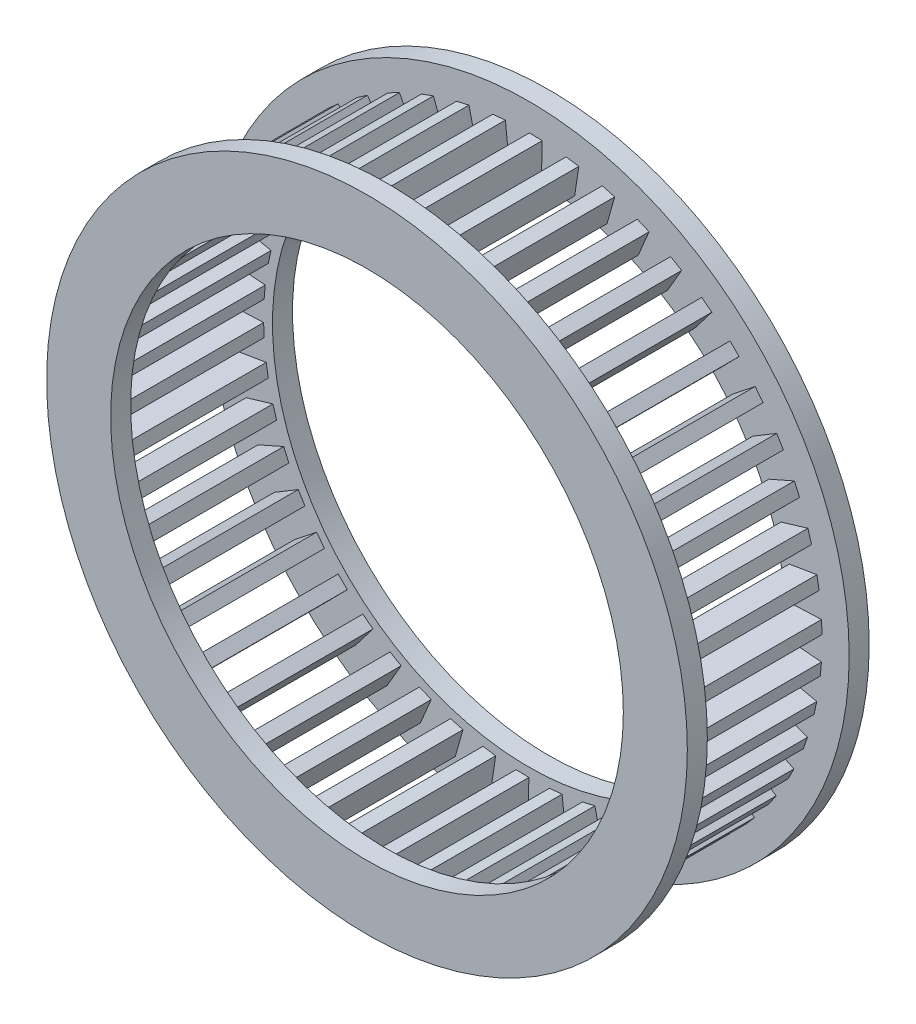
from build123d import *

# Parameters (mm, degrees)
CAGE_50_BARS_START    = -15.1
CAGE_50_BARS_DEPTH    = 30.2
CAGE_50_BARS_2_DEPTH  = 30.2
CAGE_50_BARS_3_DEPTH  = 30.2
CAGE_50_BARS_4_DEPTH  = 30.2
CAGE_50_BARS_5_DEPTH  = 30.2
CAGE_50_BARS_6_DEPTH  = 30.2
CAGE_50_BARS_7_DEPTH  = 30.2
CAGE_50_BARS_8_DEPTH  = 30.2
CAGE_50_BARS_9_DEPTH  = 30.2
CAGE_50_BARS_10_DEPTH = 30.2
CAGE_50_BARS_11_DEPTH = 30.2
CAGE_50_BARS_12_DEPTH = 30.2
CAGE_50_BARS_13_DEPTH = 30.2
CAGE_50_BARS_14_DEPTH = 30.2
CAGE_50_BARS_15_DEPTH = 30.2
CAGE_50_BARS_16_DEPTH = 30.2
CAGE_50_BARS_17_DEPTH = 30.2
CAGE_50_BARS_18_DEPTH = 30.2
CAGE_50_BARS_19_DEPTH = 30.2
CAGE_50_BARS_20_DEPTH = 30.2
CAGE_50_BARS_21_DEPTH = 30.2
CAGE_50_BARS_22_DEPTH = 30.2
CAGE_50_BARS_23_DEPTH = 30.2
CAGE_50_BARS_24_DEPTH = 30.2
CAGE_50_BARS_25_DEPTH = 30.2
CAGE_50_BARS_26_DEPTH = 30.2
CAGE_50_BARS_27_DEPTH = 30.2
CAGE_50_BARS_28_DEPTH = 30.2
CAGE_50_BARS_29_DEPTH = 30.2
CAGE_50_BARS_30_DEPTH = 30.2
CAGE_50_BARS_31_DEPTH = 30.2
CAGE_50_BARS_32_DEPTH = 30.2
CAGE_50_BARS_33_DEPTH = 30.2
CAGE_50_BARS_34_DEPTH = 30.2
CAGE_50_BARS_35_DEPTH = 30.2
CAGE_50_BARS_36_DEPTH = 30.2
CAGE_50_BARS_37_DEPTH = 30.2
CAGE_50_BARS_38_DEPTH = 30.2
CAGE_50_BARS_39_DEPTH = 30.2
CAGE_50_BARS_40_DEPTH = 30.2
CAGE_50_BARS_41_DEPTH = 30.2
CAGE_50_BARS_42_DEPTH = 30.2
CAGE_50_BARS_43_DEPTH = 30.2
CAGE_50_BARS_44_DEPTH = 30.2
CAGE_50_BARS_45_DEPTH = 30.2
CAGE_50_BARS_46_DEPTH = 30.2
CAGE_50_BARS_47_DEPTH = 30.2
CAGE_50_BARS_48_DEPTH = 30.2
CAGE_50_BARS_49_DEPTH = 30.2
CAGE_50_BARS_50_DEPTH = 30.2
CAGE_RING_RIGHT_START = 15
SKETCH_2_R            = 67.753846154
SKETCH_2_R_2          = 54.215384615
CAGE_RING_RIGHT_DEPTH = 4.230769231
CAGE_RING_LEFT_START  = -19.230769231
SKETCH_3_R            = 67.753846154
SKETCH_3_R_2          = 54.215384615
CAGE_RING_LEFT_DEPTH  = 4.230769231


with BuildPart() as part:
    # Эскиз1 → Cage_50_bars (new body)
    with BuildSketch(Plane.XY.offset(CAGE_50_BARS_START)):
        Polygon((56.087105432, 0.831147038), (62.00568864, 1.061826581), (61.900235135, 3.767464618), (55.981651927, 3.536785076), align=None)
    extrude(amount=CAGE_50_BARS_DEPTH)



with BuildPart() as body_2:
    # Эскиз1 → Cage_50_bars 2 (new body)
    with BuildSketch(Plane.XY.offset(CAGE_50_BARS_START)):
        Polygon((55.540671508, 7.854171481), (61.383673106, 8.824827218), (60.939944769, 11.495913662), (55.096943171, 10.525257926), align=None)
    extrude(amount=CAGE_50_BARS_2_DEPTH)


with BuildPart() as body_3:
    # Эскиз1 → Cage_50_bars 3 (new body)
    with BuildSketch(Plane.XY.offset(CAGE_50_BARS_START)):
        Polygon((54.118328015, 14.753330947), (59.793600378, 16.448655058), (59.018595071, 19.043065281), (53.343322707, 17.34774117), align=None)
    extrude(amount=CAGE_50_BARS_3_DEPTH)


with BuildPart() as body_4:
    # Эскиз1 → Cage_50_bars 4 (new body)
    with BuildSketch(Plane.XY.offset(CAGE_50_BARS_START)):
        Polygon((51.842506161, 21.419821571), (57.260546854, 23.813077781), (56.166486872, 26.289896384), (50.748446179, 23.896640174), align=None)
    extrude(amount=CAGE_50_BARS_4_DEPTH)


with BuildPart() as body_5:
    # Эскиз1 → Cage_50_bars 5 (new body)
    with BuildSketch(Plane.XY.offset(CAGE_50_BARS_START)):
        Polygon((48.749097015, 27.748508814), (53.824460299, 30.801954043), (52.428599623, 33.122120116), (47.353236339, 30.068674886), align=None)
    extrude(amount=CAGE_50_BARS_5_DEPTH)


with BuildPart() as body_6:
    # Эскиз1 → Cage_50_bars 6 (new body)
    with BuildSketch(Plane.XY.offset(CAGE_50_BARS_START)):
        Polygon((44.886885489, 33.639585496), (49.539529853, 37.30506509), (47.863882039, 39.431988228), (43.211237674, 35.766508634), align=None)
    extrude(amount=CAGE_50_BARS_6_DEPTH)


with BuildPart() as body_7:
    # Эскиз1 → Cage_50_bars 7 (new body)
    with BuildSketch(Plane.XY.offset(CAGE_50_BARS_START)):
        Polygon((40.316780963, 39.000145819), (44.473331427, 43.219852975), (42.544322442, 45.11999033), (38.387771978, 40.900283174), align=None)
    extrude(amount=CAGE_50_BARS_7_DEPTH)


with BuildPart() as body_8:
    # Эскиз1 → Cage_50_bars 8 (new body)
    with BuildSketch(Plane.XY.offset(CAGE_50_BARS_START)):
        Polygon((35.110856718, 43.745650546), (38.705761998, 48.45303796), (36.553813466, 50.096423231), (32.958908186, 45.389035817), align=None)
    extrude(amount=CAGE_50_BARS_8_DEPTH)


with BuildPart() as body_9:
    # Эскиз1 → Cage_50_bars 9 (new body)
    with BuildSketch(Plane.XY.offset(CAGE_50_BARS_START)):
        Polygon((29.351213289, 47.801260231), (32.32777958, 52.922089592), (29.986829015, 54.282805611), (27.010262724, 49.16197625), align=None)
    extrude(amount=CAGE_50_BARS_9_DEPTH)


with BuildPart() as body_10:
    # Эскиз1 → Cage_50_bars 10 (new body)
    with BuildSketch(Plane.XY.offset(CAGE_50_BARS_START)):
        Polygon((23.128683692, 51.103015487), (25.439968767, 56.556528258), (22.946934357, 57.61311572), (20.635649283, 52.15960295), align=None)
    extrude(amount=CAGE_50_BARS_10_DEPTH)


with BuildPart() as body_11:
    # Эскиз1 → Cage_50_bars 11 (new body)
    with BuildSketch(Plane.XY.offset(CAGE_50_BARS_START)):
        Polygon((16.541400937, 53.598845661), (18.150954449, 59.299036687), (15.545152837, 60.034832578), (13.935599325, 54.334641552), align=None)
    extrude(amount=CAGE_50_BARS_11_DEPTH)


with BuildPart() as body_12:
    # Эскиз1 → Cage_50_bars 12 (new body)
    with BuildSketch(Plane.XY.offset(CAGE_50_BARS_START)):
        Polygon((9.693250408, 55.249390021), (10.575688736, 61.106363884), (7.89821497, 61.509764263), (7.015776642, 55.6527904), align=None)
    extrude(amount=CAGE_50_BARS_12_DEPTH)


with BuildPart() as body_13:
    # Эскиз1 → Cage_50_bars 13 (new body)
    with BuildSketch(Plane.XY.offset(CAGE_50_BARS_START)):
        Polygon((2.69223153, 56.028618496), (2.833638095, 61.95000722), (0.126717536, 62.014650221), (-0.01468903, 56.093261497), align=None)
    extrude(amount=CAGE_50_BARS_13_DEPTH)


with BuildPart() as body_14:
    # Эскиз1 → Cage_50_bars 14 (new body)
    with BuildSketch(Plane.XY.offset(CAGE_50_BARS_START)):
        Polygon((-4.351245448, 55.924242187), (-4.953100712, 61.816661935), (-7.646778311, 61.5415281), (-7.044923047, 55.649108353), align=None)
    extrude(amount=CAGE_50_BARS_14_DEPTH)


with BuildPart() as body_15:
    # Эскиз1 → Cage_50_bars 15 (new body)
    with BuildSketch(Plane.XY.offset(CAGE_50_BARS_START)):
        Polygon((-11.326100686, 54.937907172), (-12.661726162, 60.708430963), (-15.299679895, 60.097859317), (-13.96405442, 54.327335526), align=None)
    extrude(amount=CAGE_50_BARS_15_DEPTH)


with BuildPart() as body_16:
    # Эскиз1 → Cage_50_bars 16 (new body)
    with BuildSketch(Plane.XY.offset(CAGE_50_BARS_START)):
        Polygon((-18.122336551, 53.085168542), (-20.170668626, 58.64279177), (-22.711296388, 57.706411392), (-20.662964312, 52.148788164), align=None)
    extrude(amount=CAGE_50_BARS_16_DEPTH)


with BuildPart() as body_17:
    # Эскиз1 → Cage_50_bars 17 (new body)
    with BuildSketch(Plane.XY.offset(CAGE_50_BARS_START)):
        Polygon((-24.632772342, 50.395245093), (-27.361507597, 55.652320719), (-29.764742169, 54.404898888), (-27.036006914, 49.147823261), align=None)
    extrude(amount=CAGE_50_BARS_17_DEPTH)


with BuildPart() as body_18:
    # Эскиз1 → Cage_50_bars 18 (new body)
    with BuildSketch(Plane.XY.offset(CAGE_50_BARS_START)):
        Polygon((-30.754734598, 46.910558523), (-34.120839249, 51.784179325), (-36.348780186, 50.245388628), (-32.982675536, 45.371767826), align=None)
    extrude(amount=CAGE_50_BARS_18_DEPTH)


with BuildPart() as body_19:
    # Эскиз1 → Cage_50_bars 19 (new body)
    with BuildSketch(Plane.XY.offset(CAGE_50_BARS_START)):
        Polygon((-36.391676318, 42.686064423), (-40.342064882, 47.099370489), (-42.359576226, 45.293478574), (-38.409187662, 40.880172508), align=None)
    extrude(amount=CAGE_50_BARS_19_DEPTH)


with BuildPart() as body_20:
    # Эскиз1 → Cage_50_bars 20 (new body)
    with BuildSketch(Plane.XY.offset(CAGE_50_BARS_START)):
        Polygon((-41.454699563, 37.788385588), (-45.927072053, 41.671776445), (-47.702336445, 39.627263306), (-43.229963954, 35.74387245), align=None)
    extrude(amount=CAGE_50_BARS_20_DEPTH)


with BuildPart() as body_21:
    # Эскиз1 → Cage_50_bars 21 (new body)
    with BuildSketch(Plane.XY.offset(CAGE_50_BARS_START)):
        Polygon((-45.863957432, 32.294761338), (-50.787781862, 35.586993592), (-52.292802321, 33.336102424), (-47.368977891, 30.04387017), align=None)
    extrude(amount=CAGE_50_BARS_21_DEPTH)


with BuildPart() as body_22:
    # Эскиз1 → Cage_50_bars 22 (new body)
    with BuildSketch(Plane.XY.offset(CAGE_50_BARS_START)):
        Polygon((-49.549913294, 26.29182941), (-54.847538012, 28.940982592), (-56.058579467, 26.519211292), (-50.760954749, 23.87005811), align=None)
    extrude(amount=CAGE_50_BARS_22_DEPTH)


with BuildPart() as body_23:
    # Эскиз1 → Cage_50_bars 23 (new body)
    with BuildSketch(Plane.XY.offset(CAGE_50_BARS_START)):
        Polygon((-52.454437424, 19.874259626), (-58.042315724, 21.838555008), (-58.940279327, 19.284096356), (-53.352401027, 17.319800975), align=None)
    extrude(amount=CAGE_50_BARS_23_DEPTH)


with BuildPart() as body_24:
    # Эскиз1 → Cage_50_bars 24 (new body)
    with BuildSketch(Plane.XY.offset(CAGE_50_BARS_START)):
        Polygon((-54.531723741, 13.143260896), (-60.321731443, 14.391720365), (-60.892455772, 11.744859702), (-55.10244807, 10.496400232), align=None)
    extrude(amount=CAGE_50_BARS_24_DEPTH)


with BuildPart() as body_25:
    # Эскиз1 → Cage_50_bars 25 (new body)
    with BuildSketch(Plane.XY.offset(CAGE_50_BARS_START)):
        Polygon((-55.7490122, 6.204985089), (-61.649837424, 6.717919696), (-61.884321815, 4.020399593), (-55.983496591, 3.507464987), align=None)
    extrude(amount=CAGE_50_BARS_25_DEPTH)


with BuildPart() as body_26:
    # Эскиз1 → Cage_50_bars 26 (new body)
    with BuildSketch(Plane.XY.offset(CAGE_50_BARS_START)):
        Polygon((-56.087105432, -0.831147038), (-62.00568864, -1.061826581), (-61.900235135, -3.767464618), (-55.981651927, -3.536785076), align=None)
    extrude(amount=CAGE_50_BARS_26_DEPTH)


with BuildPart() as body_27:
    # Эскиз1 → Cage_50_bars 27 (new body)
    with BuildSketch(Plane.XY.offset(CAGE_50_BARS_START)):
        Polygon((-55.540671508, -7.854171481), (-61.383673106, -8.824827218), (-60.939944769, -11.495913662), (-55.096943171, -10.525257926), align=None)
    extrude(amount=CAGE_50_BARS_27_DEPTH)


with BuildPart() as body_28:
    # Эскиз1 → Cage_50_bars 28 (new body)
    with BuildSketch(Plane.XY.offset(CAGE_50_BARS_START)):
        Polygon((-54.118328015, -14.753330947), (-59.793600378, -16.448655058), (-59.018595071, -19.043065281), (-53.343322707, -17.34774117), align=None)
    extrude(amount=CAGE_50_BARS_28_DEPTH)


with BuildPart() as body_29:
    # Эскиз1 → Cage_50_bars 29 (new body)
    with BuildSketch(Plane.XY.offset(CAGE_50_BARS_START)):
        Polygon((-51.842506161, -21.419821571), (-57.260546854, -23.813077781), (-56.166486872, -26.289896384), (-50.748446179, -23.896640174), align=None)
    extrude(amount=CAGE_50_BARS_29_DEPTH)


with BuildPart() as body_30:
    # Эскиз1 → Cage_50_bars 30 (new body)
    with BuildSketch(Plane.XY.offset(CAGE_50_BARS_START)):
        Polygon((-48.749097015, -27.748508814), (-53.824460299, -30.801954043), (-52.428599623, -33.122120116), (-47.353236339, -30.068674886), align=None)
    extrude(amount=CAGE_50_BARS_30_DEPTH)


with BuildPart() as body_31:
    # Эскиз1 → Cage_50_bars 31 (new body)
    with BuildSketch(Plane.XY.offset(CAGE_50_BARS_START)):
        Polygon((-44.886885489, -33.639585496), (-49.539529853, -37.30506509), (-47.863882039, -39.431988228), (-43.211237674, -35.766508634), align=None)
    extrude(amount=CAGE_50_BARS_31_DEPTH)


with BuildPart() as body_32:
    # Эскиз1 → Cage_50_bars 32 (new body)
    with BuildSketch(Plane.XY.offset(CAGE_50_BARS_START)):
        Polygon((-40.316780963, -39.000145819), (-44.473331427, -43.219852975), (-42.544322442, -45.11999033), (-38.387771978, -40.900283174), align=None)
    extrude(amount=CAGE_50_BARS_32_DEPTH)


with BuildPart() as body_33:
    # Эскиз1 → Cage_50_bars 33 (new body)
    with BuildSketch(Plane.XY.offset(CAGE_50_BARS_START)):
        Polygon((-35.110856718, -43.745650546), (-38.705761998, -48.45303796), (-36.553813466, -50.096423231), (-32.958908186, -45.389035817), align=None)
    extrude(amount=CAGE_50_BARS_33_DEPTH)


with BuildPart() as body_34:
    # Эскиз1 → Cage_50_bars 34 (new body)
    with BuildSketch(Plane.XY.offset(CAGE_50_BARS_START)):
        Polygon((-29.351213289, -47.801260231), (-32.32777958, -52.922089592), (-29.986829015, -54.282805611), (-27.010262724, -49.16197625), align=None)
    extrude(amount=CAGE_50_BARS_34_DEPTH)


with BuildPart() as body_35:
    # Эскиз1 → Cage_50_bars 35 (new body)
    with BuildSketch(Plane.XY.offset(CAGE_50_BARS_START)):
        Polygon((-23.128683692, -51.103015487), (-25.439968767, -56.556528258), (-22.946934357, -57.61311572), (-20.635649283, -52.15960295), align=None)
    extrude(amount=CAGE_50_BARS_35_DEPTH)


with BuildPart() as body_36:
    # Эскиз1 → Cage_50_bars 36 (new body)
    with BuildSketch(Plane.XY.offset(CAGE_50_BARS_START)):
        Polygon((-16.541400937, -53.598845661), (-18.150954449, -59.299036687), (-15.545152837, -60.034832578), (-13.935599325, -54.334641552), align=None)
    extrude(amount=CAGE_50_BARS_36_DEPTH)


with BuildPart() as body_37:
    # Эскиз1 → Cage_50_bars 37 (new body)
    with BuildSketch(Plane.XY.offset(CAGE_50_BARS_START)):
        Polygon((-9.693250408, -55.249390021), (-10.575688736, -61.106363884), (-7.89821497, -61.509764263), (-7.015776642, -55.6527904), align=None)
    extrude(amount=CAGE_50_BARS_37_DEPTH)


with BuildPart() as body_38:
    # Эскиз1 → Cage_50_bars 38 (new body)
    with BuildSketch(Plane.XY.offset(CAGE_50_BARS_START)):
        Polygon((-2.69223153, -56.028618496), (-2.833638095, -61.95000722), (-0.126717536, -62.014650221), (0.01468903, -56.093261497), align=None)
    extrude(amount=CAGE_50_BARS_38_DEPTH)


with BuildPart() as body_39:
    # Эскиз1 → Cage_50_bars 39 (new body)
    with BuildSketch(Plane.XY.offset(CAGE_50_BARS_START)):
        Polygon((4.351245448, -55.924242187), (4.953100712, -61.816661935), (7.646778311, -61.5415281), (7.044923047, -55.649108353), align=None)
    extrude(amount=CAGE_50_BARS_39_DEPTH)


with BuildPart() as body_40:
    # Эскиз1 → Cage_50_bars 40 (new body)
    with BuildSketch(Plane.XY.offset(CAGE_50_BARS_START)):
        Polygon((11.326100686, -54.937907172), (12.661726162, -60.708430963), (15.299679895, -60.097859317), (13.96405442, -54.327335526), align=None)
    extrude(amount=CAGE_50_BARS_40_DEPTH)


with BuildPart() as body_41:
    # Эскиз1 → Cage_50_bars 41 (new body)
    with BuildSketch(Plane.XY.offset(CAGE_50_BARS_START)):
        Polygon((18.122336551, -53.085168542), (20.170668626, -58.64279177), (22.711296388, -57.706411392), (20.662964312, -52.148788164), align=None)
    extrude(amount=CAGE_50_BARS_41_DEPTH)


with BuildPart() as body_42:
    # Эскиз1 → Cage_50_bars 42 (new body)
    with BuildSketch(Plane.XY.offset(CAGE_50_BARS_START)):
        Polygon((24.632772342, -50.395245093), (27.361507597, -55.652320719), (29.764742169, -54.404898888), (27.036006914, -49.147823261), align=None)
    extrude(amount=CAGE_50_BARS_42_DEPTH)


with BuildPart() as body_43:
    # Эскиз1 → Cage_50_bars 43 (new body)
    with BuildSketch(Plane.XY.offset(CAGE_50_BARS_START)):
        Polygon((30.754734598, -46.910558523), (34.120839249, -51.784179325), (36.348780186, -50.245388628), (32.982675536, -45.371767826), align=None)
    extrude(amount=CAGE_50_BARS_43_DEPTH)


with BuildPart() as body_44:
    # Эскиз1 → Cage_50_bars 44 (new body)
    with BuildSketch(Plane.XY.offset(CAGE_50_BARS_START)):
        Polygon((36.391676318, -42.686064423), (40.342064882, -47.099370489), (42.359576226, -45.293478574), (38.409187662, -40.880172508), align=None)
    extrude(amount=CAGE_50_BARS_44_DEPTH)


with BuildPart() as body_45:
    # Эскиз1 → Cage_50_bars 45 (new body)
    with BuildSketch(Plane.XY.offset(CAGE_50_BARS_START)):
        Polygon((41.454699563, -37.788385588), (45.927072053, -41.671776445), (47.702336445, -39.627263306), (43.229963954, -35.74387245), align=None)
    extrude(amount=CAGE_50_BARS_45_DEPTH)


with BuildPart() as body_46:
    # Эскиз1 → Cage_50_bars 46 (new body)
    with BuildSketch(Plane.XY.offset(CAGE_50_BARS_START)):
        Polygon((45.863957432, -32.294761338), (50.787781862, -35.586993592), (52.292802321, -33.336102424), (47.368977891, -30.04387017), align=None)
    extrude(amount=CAGE_50_BARS_46_DEPTH)


with BuildPart() as body_47:
    # Эскиз1 → Cage_50_bars 47 (new body)
    with BuildSketch(Plane.XY.offset(CAGE_50_BARS_START)):
        Polygon((49.549913294, -26.29182941), (54.847538012, -28.940982592), (56.058579467, -26.519211292), (50.760954749, -23.87005811), align=None)
    extrude(amount=CAGE_50_BARS_47_DEPTH)


with BuildPart() as body_48:
    # Эскиз1 → Cage_50_bars 48 (new body)
    with BuildSketch(Plane.XY.offset(CAGE_50_BARS_START)):
        Polygon((52.454437424, -19.874259626), (58.042315724, -21.838555008), (58.940279327, -19.284096356), (53.352401027, -17.319800975), align=None)
    extrude(amount=CAGE_50_BARS_48_DEPTH)


with BuildPart() as body_49:
    # Эскиз1 → Cage_50_bars 49 (new body)
    with BuildSketch(Plane.XY.offset(CAGE_50_BARS_START)):
        Polygon((54.531723741, -13.143260896), (60.321731443, -14.391720365), (60.892455772, -11.744859702), (55.10244807, -10.496400232), align=None)
    extrude(amount=CAGE_50_BARS_49_DEPTH)


with BuildPart() as body_50:
    # Эскиз1 → Cage_50_bars 50 (new body)
    with BuildSketch(Plane.XY.offset(CAGE_50_BARS_START)):
        Polygon((55.7490122, -6.204985089), (61.649837424, -6.717919696), (61.884321815, -4.020399593), (55.983496591, -3.507464987), align=None)
    extrude(amount=CAGE_50_BARS_50_DEPTH)


with BuildPart() as part_1:
    add(part.part)

    add(body_2.part)  # Cage_ring_right merges body 2

    add(body_3.part)  # Cage_ring_right merges body 3

    add(body_4.part)  # Cage_ring_right merges body 4

    add(body_5.part)  # Cage_ring_right merges body 5

    add(body_6.part)  # Cage_ring_right merges body 6

    add(body_7.part)  # Cage_ring_right merges body 7

    add(body_8.part)  # Cage_ring_right merges body 8

    add(body_9.part)  # Cage_ring_right merges body 9

    add(body_10.part)  # Cage_ring_right merges body 10

    add(body_11.part)  # Cage_ring_right merges body 11

    add(body_12.part)  # Cage_ring_right merges body 12

    add(body_13.part)  # Cage_ring_right merges body 13

    add(body_14.part)  # Cage_ring_right merges body 14

    add(body_15.part)  # Cage_ring_right merges body 15

    add(body_16.part)  # Cage_ring_right merges body 16

    add(body_17.part)  # Cage_ring_right merges body 17

    add(body_18.part)  # Cage_ring_right merges body 18

    add(body_19.part)  # Cage_ring_right merges body 19

    add(body_20.part)  # Cage_ring_right merges body 20

    add(body_21.part)  # Cage_ring_right merges body 21

    add(body_22.part)  # Cage_ring_right merges body 22

    add(body_23.part)  # Cage_ring_right merges body 23

    add(body_24.part)  # Cage_ring_right merges body 24

    add(body_25.part)  # Cage_ring_right merges body 25

    add(body_26.part)  # Cage_ring_right merges body 26

    add(body_27.part)  # Cage_ring_right merges body 27

    add(body_28.part)  # Cage_ring_right merges body 28

    add(body_29.part)  # Cage_ring_right merges body 29

    add(body_30.part)  # Cage_ring_right merges body 30

    add(body_31.part)  # Cage_ring_right merges body 31

    add(body_32.part)  # Cage_ring_right merges body 32

    add(body_33.part)  # Cage_ring_right merges body 33

    add(body_34.part)  # Cage_ring_right merges body 34

    add(body_35.part)  # Cage_ring_right merges body 35

    add(body_36.part)  # Cage_ring_right merges body 36

    add(body_37.part)  # Cage_ring_right merges body 37

    add(body_38.part)  # Cage_ring_right merges body 38

    add(body_39.part)  # Cage_ring_right merges body 39

    add(body_40.part)  # Cage_ring_right merges body 40

    add(body_41.part)  # Cage_ring_right merges body 41

    add(body_42.part)  # Cage_ring_right merges body 42

    add(body_43.part)  # Cage_ring_right merges body 43

    add(body_44.part)  # Cage_ring_right merges body 44

    add(body_45.part)  # Cage_ring_right merges body 45

    add(body_46.part)  # Cage_ring_right merges body 46

    add(body_47.part)  # Cage_ring_right merges body 47

    add(body_48.part)  # Cage_ring_right merges body 48

    add(body_49.part)  # Cage_ring_right merges body 49

    add(body_50.part)  # Cage_ring_right merges body 50
    # Эскиз2 → Cage_ring_right (add)
    with BuildSketch(Plane.XY.offset(CAGE_RING_RIGHT_START)):
        Circle(SKETCH_2_R)
        Circle(SKETCH_2_R_2, mode=Mode.SUBTRACT)
    extrude(amount=CAGE_RING_RIGHT_DEPTH)

    # Эскиз3 → Cage_ring_left (add)
    with BuildSketch(Plane.XY.offset(CAGE_RING_LEFT_START)):
        Circle(SKETCH_3_R)
        Circle(SKETCH_3_R_2, mode=Mode.SUBTRACT)
    extrude(amount=CAGE_RING_LEFT_DEPTH)


solid = part_1.part
